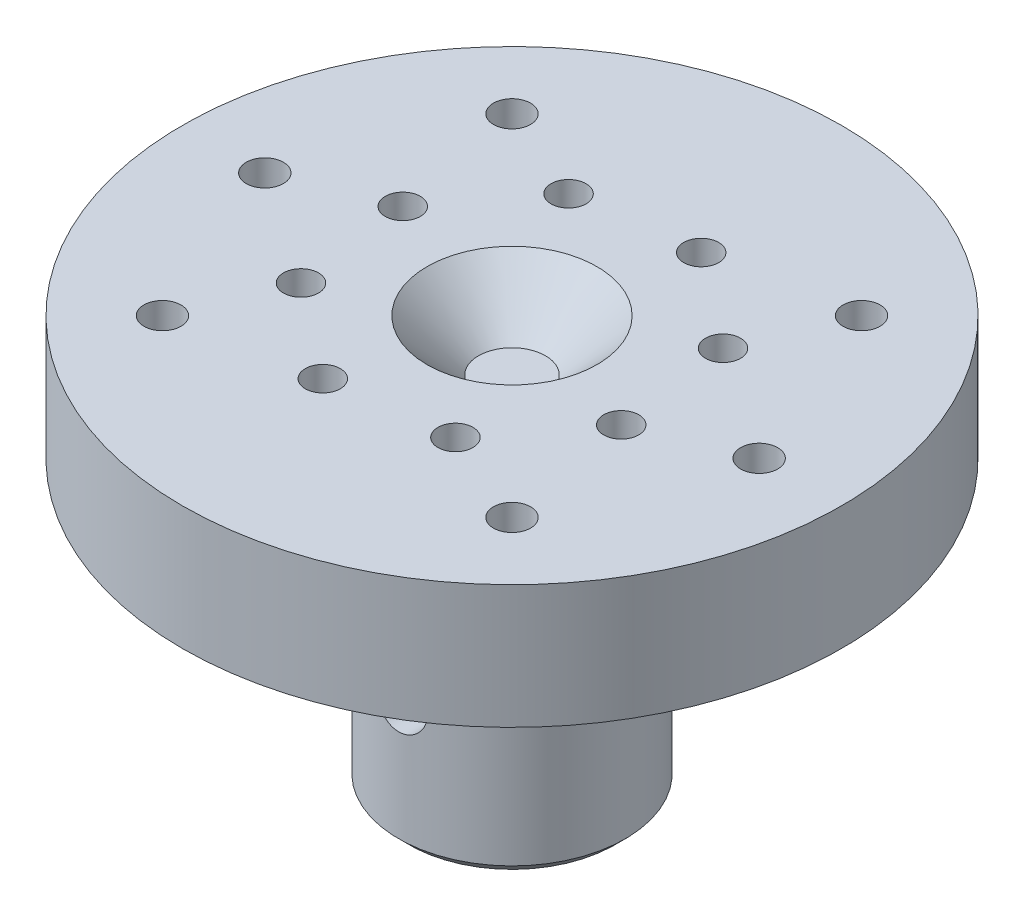
from build123d import *

# Parameters (mm, degrees)
SKETCH1_R                                            = 32
SKETCH1_R_2                                          = 8.25
BOSS_EXTRUDE1_DEPTH                                  = 12
CSK_FOR_M3_HEX_SOCKET_COUNTERSUNK_HEAD_S_D           = 3.4
CSK_FOR_M3_HEX_SOCKET_COUNTERSUNK_HEAD_S_CSINK_D     = 5.5
CSK_FOR_M3_HEX_SOCKET_COUNTERSUNK_HEAD_S_CSINK_ANGLE = 90
CSK_FOR_M3_HEX_SOCKET_COUNTERSUNK_HE_2_D             = 3.6
CSK_FOR_M3_HEX_SOCKET_COUNTERSUNK_HE_2_CSINK_D       = 6.94
CSK_FOR_M3_HEX_SOCKET_COUNTERSUNK_HE_2_CSINK_ANGLE   = 90
BOSS_EXTRUDE2_DEPTH                                  = 27.5
BOSS_EXTRUDE2_DEPTH_BACK                             = 7
SKETCH10_R                                           = 19
SKETCH10_R_2                                         = 2.75
CUT_EXTRUDE2_START                                   = -25.5
SKETCH11_R                                           = 19
SKETCH11_R_2                                         = 11
CUT_EXTRUDE2_DEPTH                                   = 25.5
CHAMFER1_SIZE                                        = 5
CHAMFER2_SIZE                                        = 1
F_4_2_4_2_DIAMETER_HOLE1_D                           = 4.2
SKETCH27_R                                           = 2.5
CUT_EXTRUDE3_DEPTH                                   = 8.5
CUT_EXTRUDE4_START                                   = 8.5
SKETCH28_R                                           = 2.5
CUT_EXTRUDE4_DEPTH                                   = 8.5


with BuildPart() as part:
    # Sketch1 → Boss-Extrude1 (new body)
    with BuildSketch(Plane(origin=(0, 0, 0), x_dir=(1, 0, 0), z_dir=(0, 1, 0))):
        with Locations(Location((0, 0, 0), (0, 0, 270))):
            Circle(SKETCH1_R)
        with Locations(Location((0, 0, 0), (0, 0, 270))):
            Circle(SKETCH1_R_2, mode=Mode.SUBTRACT)
    extrude(amount=BOSS_EXTRUDE1_DEPTH)

    # CSK for M3 Hex Socket Countersunk Head S (through all)
    with Locations(Plane.XZ):
        with Locations((3.882285677, -14.488887394), (12.990381057, -7.5), (14.488887394, 3.882285677), (7.5, 12.990381057), (-3.882285677, 14.488887394), (-12.990381057, 7.5), (-14.488887394, -3.882285677), (-7.5, -12.990381057)):
            CounterSinkHole(CSK_FOR_M3_HEX_SOCKET_COUNTERSUNK_HEAD_S_D / 2, CSK_FOR_M3_HEX_SOCKET_COUNTERSUNK_HEAD_S_CSINK_D / 2, counter_sink_angle=CSK_FOR_M3_HEX_SOCKET_COUNTERSUNK_HEAD_S_CSINK_ANGLE)

    # CSK for M3 Hex Socket Countersunk He 2 (through all)
    with Locations(Plane(origin=(0, 0, 0), x_dir=(-1, 0, 0), z_dir=(0, -1, 0))):
        with Locations((-16.970562748, -16.970562748), (-24, 0), (-16.970562748, 16.970562748), (16.970562748, 16.970562748), (24, 0), (16.970562748, -16.970562748)):
            CounterSinkHole(CSK_FOR_M3_HEX_SOCKET_COUNTERSUNK_HE_2_D / 2, CSK_FOR_M3_HEX_SOCKET_COUNTERSUNK_HE_2_CSINK_D / 2, counter_sink_angle=CSK_FOR_M3_HEX_SOCKET_COUNTERSUNK_HE_2_CSINK_ANGLE)

    # Sketch10 → Boss-Extrude2 (add, two sides: drawn at the far end of the back side and taken through both)
    with BuildSketch(Plane.XZ.offset(-BOSS_EXTRUDE2_DEPTH_BACK)):
        with Locations(Location((0, 0, 0), (0, 0, 270))):
            Circle(SKETCH10_R)
        with Locations(Location((7.5, 12.990381057, 0), (0, 0, 270))):
            Circle(SKETCH10_R_2, mode=Mode.SUBTRACT)
        with Locations(Location((14.488887394, 3.882285677, 0), (0, 0, 270))):
            Circle(SKETCH10_R_2, mode=Mode.SUBTRACT)
        with Locations(Location((12.990381057, -7.5, 0), (0, 0, 270))):
            Circle(SKETCH10_R_2, mode=Mode.SUBTRACT)
        with Locations(Location((3.882285677, -14.488887394, 0), (0, 0, 270))):
            Circle(SKETCH10_R_2, mode=Mode.SUBTRACT)
        with Locations(Location((-7.5, -12.990381057, 0), (0, 0, 270))):
            Circle(SKETCH10_R_2, mode=Mode.SUBTRACT)
        with Locations(Location((-14.488887394, -3.882285677, 0), (0, 0, 270))):
            Circle(SKETCH10_R_2, mode=Mode.SUBTRACT)
        with Locations(Location((-12.990381057, 7.5, 0), (0, 0, 270))):
            Circle(SKETCH10_R_2, mode=Mode.SUBTRACT)
        with Locations(Location((-3.882285677, 14.488887394, 0), (0, 0, 270))):
            Circle(SKETCH10_R_2, mode=Mode.SUBTRACT)
    extrude(amount=BOSS_EXTRUDE2_DEPTH + BOSS_EXTRUDE2_DEPTH_BACK)

    # Sketch11 → Cut-Extrude2 (cut)
    with BuildSketch(Plane.XZ.offset(27.5).offset(CUT_EXTRUDE2_START)):
        with Locations(Location((0, 0, 0), (0, 0, 270))):
            Circle(SKETCH11_R)
        with Locations(Location((0, 0, 0), (0, 0, 270))):
            Circle(SKETCH11_R_2, mode=Mode.SUBTRACT)
    extrude(amount=CUT_EXTRUDE2_DEPTH, mode=Mode.SUBTRACT)

    # Chamfer1
    chamfer1_edges = [part.edges().sort_by_distance(p)[0] for p in [
        (0, 7, -8.25),
    ]]
    chamfer(chamfer1_edges, length=CHAMFER1_SIZE - 0.0001)  # a hair under: the kernel refuses the full size

    # Chamfer2
    chamfer2_edges = [part.edges().sort_by_distance(p)[0] for p in [
        (0, -27.5, 11),
    ]]
    chamfer(chamfer2_edges, length=CHAMFER2_SIZE)

    # Ø4.2 (4.2) Diameter Hole1 (through all)
    with Locations(Plane.XY.offset(15)):
        with Locations((0, -15)):
            Hole(F_4_2_4_2_DIAMETER_HOLE1_D / 2)

    # Sketch27 → Cut-Extrude3 (cut)
    with BuildSketch(Plane.XY.offset(15)):
        with Locations((0, -15)):
            Circle(SKETCH27_R)
    extrude(amount=-CUT_EXTRUDE3_DEPTH, mode=Mode.SUBTRACT)

    # Sketch28 → Cut-Extrude4 (cut)
    with BuildSketch(Plane.XY.offset(-15).offset(CUT_EXTRUDE4_START)):
        with Locations((0, -15)):
            Circle(SKETCH28_R)
    extrude(amount=-CUT_EXTRUDE4_DEPTH, mode=Mode.SUBTRACT)


solid = part.part
